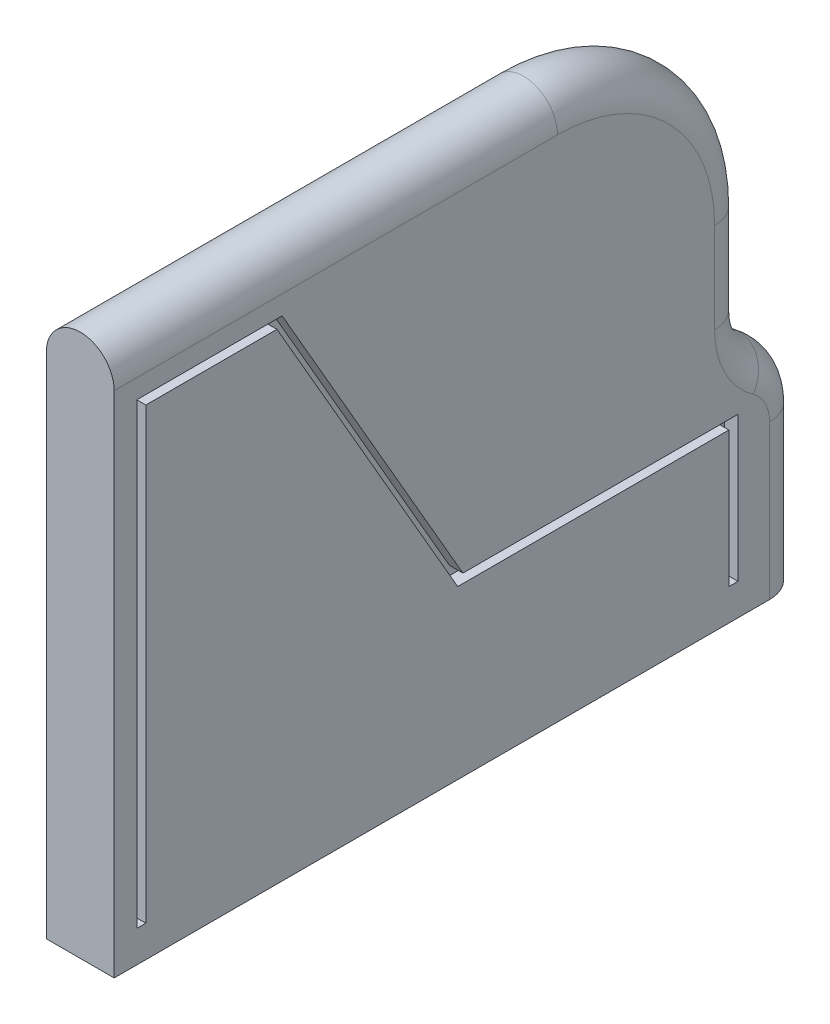
from build123d import *

# Parameters (mm, degrees)
BOSS_EXTRUDE1_DEPTH = 15
CUT_EXTRUDE4_DEPTH  = 3
FILLET1_R           = 7.5


with BuildPart() as part:
    # Sketch1 → Boss-Extrude1 (new body)
    with BuildSketch(Plane(origin=(0, 0, 0), x_dir=(0, 0, -1), z_dir=(1, 0, 0))):
        with BuildLine():
            Line((105.176560834, -44.266250702), (105.176560834, -78.308566478))
            Line((105.176560834, -78.308566478), (-47.323439166, -78.308566478))
            Line((-47.323439166, -78.308566478), (-47.323439166, 41.691433522))
            Line((-47.323439166, 41.691433522), (50.746660587, 41.691433522))
            ThreePointArc((50.746660587, 41.691433522), (80.628611175, 29.313924319), (93.006120378, -0.568026269))
            Line((93.006120378, -0.568026269), (93.006120378, -20.545339005))
            ThreePointArc((93.006120378, -20.545339005), (94.435922822, -26.464268202), (98.409995921, -31.077813571))
            ThreePointArc((98.409995921, -31.077813571), (103.386206676, -36.854751618), (105.176560834, -44.266250702))
        make_face()
    extrude(amount=BOSS_EXTRUDE1_DEPTH)

    # Sketch3 → Cut-Extrude4 (cut)
    with BuildSketch(Plane(origin=(15, 0, 0), x_dir=(0, 0, -1), z_dir=(1, 0, 0))):
        Polygon((90.676560834, -71.308566478), (90.676560834, -39.308566478), (29.831261372, -39.308566478), (-10.168738628, 29.973465825), (-42.323439166, 29.973465825), (-42.323439166, -71.308566478), (-40.323439166, -71.308566478), (-40.323439166, 27.973465825), (-11.323439166, 27.973465825), (28.676560834, -41.308566478), (88.676560834, -41.308566478), (88.676560834, -71.308566478), align=None)
    extrude(amount=-CUT_EXTRUDE4_DEPTH, mode=Mode.SUBTRACT)

    # Fillet1
    fillet1_edges = [part.edges().sort_by_distance(p)[0] for p in [
        (15, 29.313924319, -80.628611175),
        (0, -10.556682637, -93.006120378),
        (0, -26.464268202, -94.435922822),
        (15, 41.691433522, -1.711610711),
        (15, -61.28740859, -105.176560834),
        (15, -36.854751618, -103.386206676),
        (15, -10.556682637, -93.006120378),
        (0, -61.28740859, -105.176560834),
        (0, 41.691433522, -1.711610711),
    ]]
    fillet(fillet1_edges, radius=FILLET1_R - 0.0001)  # a hair under: the kernel refuses the full size


solid = part.part
